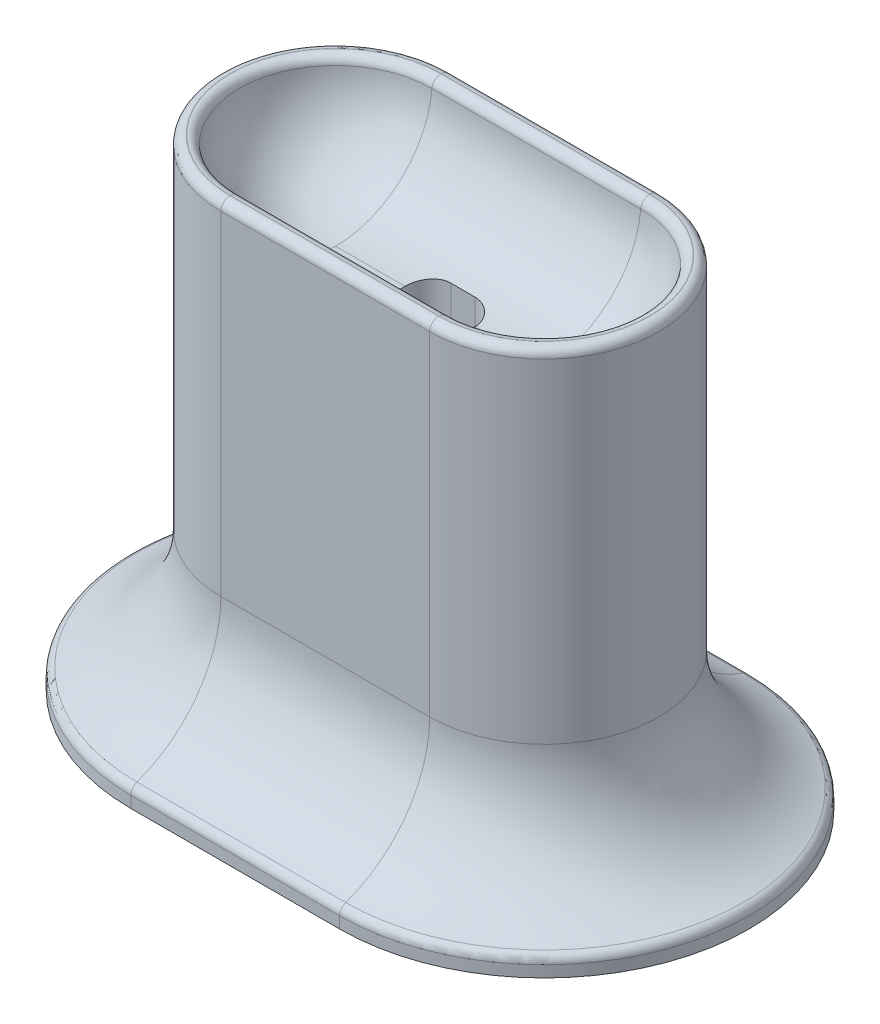
from build123d import *

# Parameters (mm, degrees)
BOSS_EXTRUDE1_DEPTH     = 53.5
BOSS_EXTRUDE2_START     = 32.75
BOSS_EXTRUDE2_DEPTH     = 10
BOSS_EXTRUDE3_DEPTH     = 2
FILLET1_R               = 10.75
FILLET2_R               = 14
FILLET3_R               = 1
CUT_EXTRUDE4_DEPTH      = 79.076260797
CUT_EXTRUDE5_DEPTH      = 61.840180017
CUT_EXTRUDE5_DEPTH_BACK = 61.840180017


# Some blends are built 0.0001 mm under size
with BuildPart() as part:
    # Sketch2 → Boss-Extrude1 (new body)
    with BuildSketch(Plane(origin=(0, 0, 0), x_dir=(1, 0, 0), z_dir=(0, 1, 0))):
        with BuildLine():
            Line((0, -12.75), (23.2, -12.75))
            ThreePointArc((23.2, -12.75), (35.95, 0), (23.2, 12.75))
            Line((23.2, 12.75), (0, 12.75))
            ThreePointArc((0, 12.75), (-12.75, 0), (0, -12.75))
        make_face()
        with BuildLine():
            ThreePointArc((23.2, -10.75), (33.95, 0), (23.2, 10.75))
            Line((23.2, 10.75), (0, 10.75))
            ThreePointArc((0, 10.75), (-10.75, 0), (0, -10.75))
            Line((0, -10.75), (23.2, -10.75))
        make_face(mode=Mode.SUBTRACT)
    extrude(amount=BOSS_EXTRUDE1_DEPTH)

    # Sketch2<3> → Boss-Extrude2 (add)
    with BuildSketch(Plane(origin=(0, 0, 0), x_dir=(1, 0, 0), z_dir=(0, 1, 0)).offset(BOSS_EXTRUDE2_START)):
        with BuildLine():
            Line((0, -10.75), (23.2, -10.75))
            ThreePointArc((23.2, -10.75), (33.95, 0), (23.2, 10.75))
            Line((23.2, 10.75), (0, 10.75))
            ThreePointArc((0, 10.75), (-10.75, 0), (0, -10.75))
        make_face()
    extrude(amount=BOSS_EXTRUDE2_DEPTH)

    # Sketch2<4> → Boss-Extrude3 (add)
    with BuildSketch(Plane(origin=(0, 0, 0), x_dir=(1, 0, 0), z_dir=(0, 1, 0))):
        with BuildLine():
            Line((0, 22.75), (23.2, 22.75))
            ThreePointArc((23.2, 22.75), (45.95, 0), (23.2, -22.75))
            Line((23.2, -22.75), (0, -22.75))
            ThreePointArc((0, -22.75), (-22.75, 0), (0, 22.75))
        make_face()
        with BuildLine():
            ThreePointArc((23.2, -12.75), (35.95, 0), (23.2, 12.75))
            Line((23.2, 12.75), (0, 12.75))
            ThreePointArc((0, 12.75), (-12.75, 0), (0, -12.75))
            Line((0, -12.75), (23.2, -12.75))
        make_face(mode=Mode.SUBTRACT)
    extrude(amount=BOSS_EXTRUDE3_DEPTH)

    # Fillet1
    fillet1_edges = [part.edges().sort_by_distance(p)[0] for p in [
        (11.6, 42.75, -10.75),
        (33.95, 42.75, 0),
        (11.6, 42.75, 10.75),
        (-10.75, 42.75, 0),
    ]]
    fillet(fillet1_edges, radius=FILLET1_R - 0.0001)  # a hair under: the kernel refuses the full size

    # Fillet2
    # the kernel refuses this fillet: 14 mm, written as the material it adds along each edge
    with BuildSketch(Plane(origin=(23.2, 2, 0), x_dir=(0, 0, 1), z_dir=(-1, 0, 0))) as fillet2_piece_1:
        with BuildLine():
            CenterArc((26.75, 13.416407865), FILLET2_R, 180, 73.398450401)
            Line((22.75, 0), (22.67, -0.268328157))
            ThreePointArc((22.67, -0.268328157), (17.75, -0.28), (12.75, -0.28))
            Line((12.75, -0.28), (12.47, 0))
            Line((12.47, 0), (12.47, 13.416407865))
            Line((12.47, 13.416407865), (12.75, 13.416407865))
        make_face()
    revolve(axis=Axis((23.2, 2, 0), (0, 1, 0)), revolution_arc=180)
    with BuildSketch(Plane(origin=(0, 2, 12.75), x_dir=(0, 1, 0), z_dir=(1, 0, 0)), Plane(origin=(23.2, 2, -12.75), x_dir=(0, 1, 0), z_dir=(-1, 0, 0))) as fillet2_piece_2:
        with BuildLine():
            CenterArc((13.416407865, 14), FILLET2_R, 196.601549599, 73.398450401)
            Line((0, 10), (-0.268328157, 9.92))
            ThreePointArc((-0.268328157, 9.92), (-0.28, 5), (-0.28, 0))
            Line((-0.28, 0), (0, -0.28))
            Line((0, -0.28), (13.416407865, -0.28))
            Line((13.416407865, -0.28), (13.416407865, 0))
        make_face()
    extrude(amount=23.2)
    with BuildSketch(Plane(origin=(0, 2, 0), x_dir=(0, 0, -1), z_dir=(1, 0, 0))) as fillet2_piece_3:
        with BuildLine():
            CenterArc((26.75, 13.416407865), FILLET2_R, 180, 73.398450401)
            Line((22.75, 0), (22.67, -0.268328157))
            ThreePointArc((22.67, -0.268328157), (17.75, -0.28), (12.75, -0.28))
            Line((12.75, -0.28), (12.47, 0))
            Line((12.47, 0), (12.47, 13.416407865))
            Line((12.47, 13.416407865), (12.75, 13.416407865))
        make_face()
    revolve(axis=Axis((0, 2, 0), (0, 1, 0)), revolution_arc=180)

    # Fillet3
    # the kernel refuses this fillet: 1 mm, written as the material it takes off along each edge
    with BuildSketch(Plane(origin=(0, 53.5, 10.75), x_dir=(0, 0, 1), z_dir=(1, 0, 0)), Plane(origin=(23.2, 53.5, -10.75), x_dir=(0, 0, -1), z_dir=(-1, 0, 0))) as fillet3_piece_1:
        with BuildLine():
            CenterArc((0.957377651, 1), FILLET3_R, 184.881694581, 85.118305419)
            Line((-0.038994884, 0.914901403), (-0.138632138, 0.906391544))
            ThreePointArc((-0.138632138, 0.906391544), (-0.1, 0.0001), (-0.1, 0))
            Line((-0.1, 0), (0, -0.1))
            Line((0, -0.1), (0.957377651, -0.1))
            Line((0.957377651, -0.1), (0.957377651, 0))
        make_face()
    extrude(amount=23.2, mode=Mode.SUBTRACT)
    with BuildSketch(Plane(origin=(0, 53.5, 0), x_dir=(0, 0, -1), z_dir=(1, 0, 0))) as fillet3_piece_2:
        with BuildLine():
            CenterArc((11.707377651, -1), FILLET3_R, 90, 85.118305419)
            Line((10.711005116, -0.914901403), (10.611367862, -0.906391544))
            ThreePointArc((10.611367862, -0.906391544), (10.65, -0.0001), (10.65, 0))
            Line((10.65, 0), (10.75, 0.1))
            Line((10.75, 0.1), (11.707377651, 0.1))
            Line((11.707377651, 0.1), (11.707377651, 0))
        make_face()
    revolve(axis=Axis((0, 53.5, 0), (0, 1, 0)), revolution_arc=180, mode=Mode.SUBTRACT)
    with BuildSketch(Plane(origin=(0, 53.5, 12.75), x_dir=(0, -1, 0), z_dir=(1, 0, 0))) as fillet3_piece_3:
        with BuildLine():
            CenterArc((FILLET3_R, FILLET3_R), FILLET3_R, 180, 90)
            Line((0, FILLET3_R), (0, 0))
            Line((0, 0), (FILLET3_R, 0))
        make_face()
    extrude(amount=23.2, mode=Mode.SUBTRACT)
    with BuildSketch(Plane(origin=(23.2, 53.5, 0), x_dir=(0, 0, 1), z_dir=(-1, 0, 0))) as fillet3_piece_4:
        with BuildLine():
            CenterArc((12.75 - FILLET3_R, -FILLET3_R), FILLET3_R, 0, 90)
            Line((12.75, -FILLET3_R), (12.75, 0))
            Line((12.75, 0), (12.75 - FILLET3_R, 0))
        make_face()
    revolve(axis=Axis((23.2, 53.5, 0), (0, 1, 0)), revolution_arc=180, mode=Mode.SUBTRACT)
    with BuildSketch(Plane(origin=(23.2, 53.5, -12.75), x_dir=(0, 0, 1), z_dir=(-1, 0, 0))) as fillet3_piece_5:
        with BuildLine():
            CenterArc((FILLET3_R, -FILLET3_R), FILLET3_R, 90, 90)
            Line((0, -FILLET3_R), (0, 0))
            Line((0, 0), (FILLET3_R, 0))
        make_face()
    extrude(amount=23.2, mode=Mode.SUBTRACT)
    with BuildSketch(Plane(origin=(0, 53.5, 0), x_dir=(0, 0, -1), z_dir=(1, 0, 0))) as fillet3_piece_6:
        with BuildLine():
            CenterArc((12.75 - FILLET3_R, -FILLET3_R), FILLET3_R, 0, 90)
            Line((12.75 - FILLET3_R, 0), (12.75, 0))
            Line((12.75, 0), (12.75, -FILLET3_R))
        make_face()
    revolve(axis=Axis((0, 53.5, 0), (0, 1, 0)), revolution_arc=180, mode=Mode.SUBTRACT)
    with BuildSketch(Plane(origin=(0, 2, -22.75), x_dir=(0, 0.30962089103713925, 0.9508600863604318), z_dir=(1, 0, 0)), Plane(origin=(23.2, 2, 22.75), x_dir=(0, 0.30962089103713925, -0.9508600863604318), z_dir=(-1, 0, 0))) as fillet3_piece_7:
        with BuildLine():
            CenterArc((0.726159611, 0.99968645), FILLET3_R, 198.036385117, 70.528779366)
            Line((-0.224700475, 0.690065559), (0, 0))
            ThreePointArc((0, 0), (0.350559812, 0.004389695), (0.701119624, 0))
        make_face()
    extrude(amount=23.2, mode=Mode.SUBTRACT)
    with BuildSketch(Plane(origin=(0, 2, 0), x_dir=(0, 0, 1), z_dir=(1, 0, 0))) as fillet3_piece_8:
        with BuildLine():
            CenterArc((21.75, 0.725727759), FILLET3_R, 289.471220634, 70.528779366)
            Line((22.75, 0.725727759), (22.75, 0))
            ThreePointArc((22.75, 0), (22.415307525, -0.104366656), (22.083333333, -0.217081283))
        make_face()
    revolve(axis=Axis((0, 2, 0), (0, -1, 0)), revolution_arc=180, mode=Mode.SUBTRACT)
    with BuildSketch(Plane(origin=(23.2, 2, 0), x_dir=(0, 0, -1), z_dir=(-1, 0, 0))) as fillet3_piece_9:
        with BuildLine():
            CenterArc((21.75, 0.725727759), FILLET3_R, 289.471220634, 70.528779366)
            Line((22.75, 0.725727759), (22.75, 0))
            ThreePointArc((22.75, 0), (22.415307525, -0.104366656), (22.083333333, -0.217081283))
        make_face()
    revolve(axis=Axis((23.2, 2, 0), (0, -1, 0)), revolution_arc=180, mode=Mode.SUBTRACT)
    with BuildSketch(Plane(origin=(23.2, 53.5, 0), x_dir=(0, 0, 1), z_dir=(-1, 0, 0))) as fillet3_piece_10:
        with BuildLine():
            CenterArc((11.707377651, -1), FILLET3_R, 90, 85.118305419)
            Line((10.711005116, -0.914901403), (10.611367862, -0.906391544))
            ThreePointArc((10.611367862, -0.906391544), (10.65, -0.0001), (10.65, 0))
            Line((10.65, 0), (10.75, 0.1))
            Line((10.75, 0.1), (11.707377651, 0.1))
            Line((11.707377651, 0.1), (11.707377651, 0))
        make_face()
    revolve(axis=Axis((23.2, 53.5, 0), (0, 1, 0)), revolution_arc=180, mode=Mode.SUBTRACT)

    # Sketch4 → Cut-Extrude4 (cut, through all)
    with BuildSketch(Plane.XY.offset(-10.75)):
        with BuildLine():
            Line((11.6, 0), (12.85, 0))
            Line((12.85, 0), (12.85, 2.002168665))
            ThreePointArc((12.85, 2.002168665), (11.6, 4.331324862), (10.35, 2.002168665))
            Line((10.35, 2.002168665), (10.35, 0))
            Line((10.35, 0), (11.6, 0))
        make_face()
    extrude(amount=-CUT_EXTRUDE4_DEPTH, mode=Mode.SUBTRACT)

    # Sketch3 → Cut-Extrude5 (cut, two sides: drawn at the far end of the back side and taken through both)
    with BuildSketch(Plane.XZ.offset(-32.75).offset(-CUT_EXTRUDE5_DEPTH_BACK)):
        with BuildLine():
            Line((12.95, 2.55), (10.25, 2.55))
            ThreePointArc((10.25, 2.55), (7.7, 0), (10.25, -2.55))
            Line((10.25, -2.55), (12.95, -2.55))
            ThreePointArc((12.95, -2.55), (15.5, 0), (12.95, 2.55))
        make_face()
    extrude(amount=CUT_EXTRUDE5_DEPTH + CUT_EXTRUDE5_DEPTH_BACK, mode=Mode.SUBTRACT)


solid = part.part
